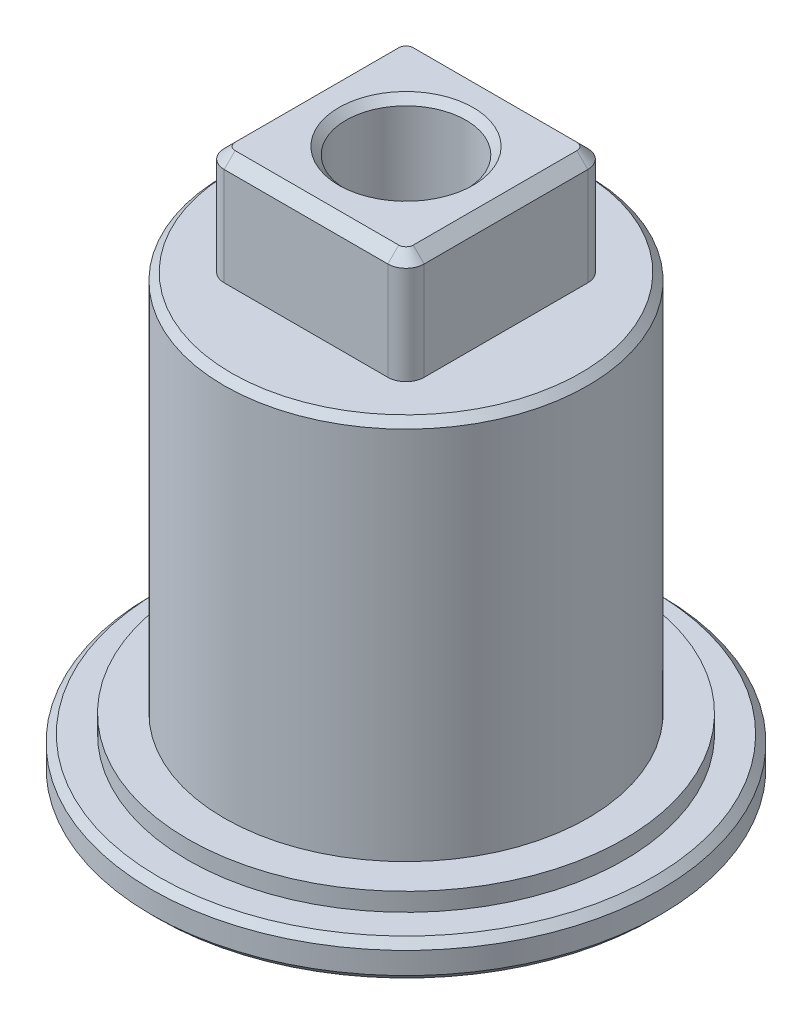
from build123d import *

# Parameters (mm, degrees)
SKETCH_1_R          = 7
SKETCH_1_R_2        = 1.65
EXTRUDE_1_DEPTH     = 1
SKETCH_1_4_R        = 6
SKETCH_1_4_R_2      = 1.65
EXTRUDE_2_DEPTH     = 1.5
SKETCH_1_5_R        = 5
SKETCH_1_5_R_2      = 1.65
EXTRUDE_3_DEPTH     = 12
EXTRUDE_START       = 2
SKETCH_1_6_R        = 4.25
SKETCH_1_6_W        = 5.5
SKETCH_1_6_H        = 5.5
EXTRUDE_4_DEPTH     = 10
SKETCH_1_7_W        = 5.5
SKETCH_1_7_H        = 5.5
SKETCH_1_7_R        = 1.65
EXTRUDE_5_DEPTH     = 13
SKETCH_1_8_R        = 1.65
EXTRUDE_6_DEPTH     = 2
CUT_EXTRUDE_1_DEPTH = 2
FILLET_1_R          = 0.5
CHAMFER_1_SIZE      = 0.2
CHAMFER_2_SIZE      = 0.3


with BuildPart() as part:
    # 스케치1 → 보스-돌출1 (new body)
    with BuildSketch(Plane(origin=(0, 0, 0), x_dir=(1, 0, 0), z_dir=(0, 1, 0))):
        Circle(SKETCH_1_R)
        Circle(SKETCH_1_R_2, mode=Mode.SUBTRACT)
    extrude(amount=EXTRUDE_1_DEPTH)

    # 스케치1<4> → 보스-돌출2 (add)
    with BuildSketch(Plane(origin=(0, 0, 0), x_dir=(1, 0, 0), z_dir=(0, 1, 0))):
        Circle(SKETCH_1_4_R)
        Circle(SKETCH_1_4_R_2, mode=Mode.SUBTRACT)
    extrude(amount=EXTRUDE_2_DEPTH)

    # 스케치1<5> → 보스-돌출3 (add)
    with BuildSketch(Plane(origin=(0, 0, 0), x_dir=(1, 0, 0), z_dir=(0, 1, 0))):
        Circle(SKETCH_1_5_R)
        Circle(SKETCH_1_5_R_2, mode=Mode.SUBTRACT)
    extrude(amount=EXTRUDE_3_DEPTH)

    # 스케치1<6> → 보스-돌출4 (add)
    with BuildSketch(Plane(origin=(0, 0, 0), x_dir=(1, 0, 0), z_dir=(0, 1, 0)).offset(EXTRUDE_START)):
        Circle(SKETCH_1_6_R)
        Rectangle(SKETCH_1_6_W, SKETCH_1_6_H, mode=Mode.SUBTRACT)
    extrude(amount=EXTRUDE_4_DEPTH)

    # 스케치1<7> → 보스-돌출5 (add)
    with BuildSketch(Plane(origin=(0, 0, 0), x_dir=(1, 0, 0), z_dir=(0, 1, 0)).offset(EXTRUDE_START)):
        Rectangle(SKETCH_1_7_W, SKETCH_1_7_H)
        Circle(SKETCH_1_7_R, mode=Mode.SUBTRACT)
    extrude(amount=EXTRUDE_5_DEPTH)

    # 스케치1<8> → 보스-돌출6 (add)
    with BuildSketch(Plane(origin=(0, 0, 0), x_dir=(1, 0, 0), z_dir=(0, 1, 0))):
        Circle(SKETCH_1_8_R)
    extrude(amount=EXTRUDE_6_DEPTH)

    # 스케치2 → 컷-돌출1 (cut)
    with BuildSketch(Plane.XZ):
        with BuildLine():
            ThreePointArc((-1, -3), (0, -4), (1, -3))
            Line((1, -3), (1, 3))
            ThreePointArc((1, 3), (0, 4), (-1, 3))
            Line((-1, 3), (-1, -3))
        make_face()
    extrude(amount=-CUT_EXTRUDE_1_DEPTH, mode=Mode.SUBTRACT)

    # 필렛1
    fillet_1_edges = [part.edges().sort_by_distance(p)[0] for p in [
        (2.75, 13.5, 2.75),
        (2.75, 13.5, -2.75),
        (-2.75, 13.5, -2.75),
        (-2.75, 13.5, 2.75),
    ]]
    fillet(fillet_1_edges, radius=FILLET_1_R)

    # 모따기1
    chamfer_1_edges = [part.edges().sort_by_distance(p)[0] for p in [
        (-5, 12, 0),
        (-7, 1, 0),
        (-7, 0, 0),
        (-1.65, 15, 0),
    ]]
    chamfer(chamfer_1_edges, length=CHAMFER_1_SIZE)

    # 모따기2
    chamfer_2_edges = [part.edges().sort_by_distance(p)[0] for p in [
        (2.75, 15, 0),
        (0, 15, 2.75),
        (-2.75, 15, 0),
        (0, 15, -2.75),
        (-2.603553391, 15, 2.603553391),
        (2.603553391, 15, 2.603553391),
        (-2.603553391, 15, -2.603553391),
        (2.603553391, 15, -2.603553391),
    ]]
    chamfer(chamfer_2_edges, length=CHAMFER_2_SIZE)

    # 스케치3 → 컷-회전1 (revolve, cut)
    with BuildSketch(Plane(origin=(0, 0, 0), x_dir=(0, 0, -1), z_dir=(1, 0, 0))):
        Polygon((0, 1.316547622), (0, 2), (-1.65, 2), align=None)
    revolve(axis=Axis((0, 11.8, 0), (0, -1, 0)), mode=Mode.SUBTRACT)


solid = part.part
